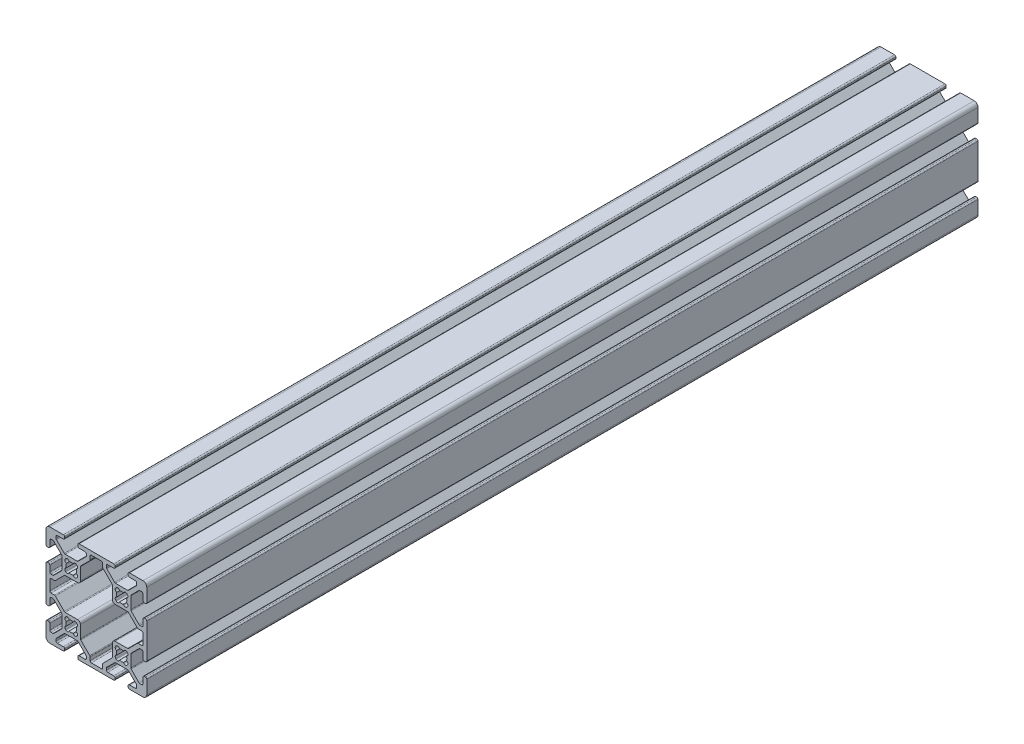
from build123d import *

# Parameters (mm, degrees)
EXTRUDE1_DEPTH = 330


with BuildPart() as part:
    # Sketch1 → Extrude1 (new body)
    with BuildSketch(Plane.XY):
        with BuildLine():
            Line((-22.383919339, -3.655), (-17.616080661, -3.655))
            ThreePointArc((-17.616080661, -3.655), (-17.421677478, -3.693669197), (-17.256870417, -3.803789755))
            Line((-17.256870417, -3.803789755), (-14.153789755, -6.906870417))
            ThreePointArc((-14.153789755, -6.906870417), (-14.043669197, -7.071677478), (-14.005, -7.266080661))
            Line((-14.005, -7.266080661), (-14.005, -7.992))
            ThreePointArc((-14.005, -7.992), (-14.153789755, -8.351210245), (-14.513, -8.5))
            Line((-14.513, -8.5), (-16.862, -8.5))
            ThreePointArc((-16.862, -8.5), (-17.221210245, -8.648789755), (-17.37, -9.008))
            Line((-17.37, -9.008), (-17.37, -9.492))
            ThreePointArc((-17.37, -9.492), (-17.221210245, -9.851210245), (-16.862, -10))
            Line((-16.862, -10), (-3.138, -10))
            ThreePointArc((-3.138, -10), (-2.778789755, -9.851210245), (-2.63, -9.492))
            Line((-2.63, -9.492), (-2.63, -9.008))
            ThreePointArc((-2.63, -9.008), (-2.778789755, -8.648789755), (-3.138, -8.5))
            Line((-3.138, -8.5), (-5.487, -8.5))
            ThreePointArc((-5.487, -8.5), (-5.846210245, -8.351210245), (-5.995, -7.992))
            Line((-5.995, -7.992), (-5.995, -7.266080661))
            ThreePointArc((-5.995, -7.266080661), (-5.956330803, -7.071677478), (-5.846210245, -6.906870417))
            Line((-5.846210245, -6.906870417), (-2.743129583, -3.803789755))
            ThreePointArc((-2.743129583, -3.803789755), (-2.578322522, -3.693669197), (-2.383919339, -3.655))
            Line((-2.383919339, -3.655), (2.383919339, -3.655))
            ThreePointArc((2.383919339, -3.655), (2.578322522, -3.693669197), (2.743129583, -3.803789755))
            Line((2.743129583, -3.803789755), (5.846210245, -6.906870417))
            ThreePointArc((5.846210245, -6.906870417), (5.956330803, -7.071677478), (5.995, -7.266080661))
            Line((5.995, -7.266080661), (5.995, -7.992))
            ThreePointArc((5.995, -7.992), (5.846210245, -8.351210245), (5.487, -8.5))
            Line((5.487, -8.5), (3.138, -8.5))
            ThreePointArc((3.138, -8.5), (2.778789755, -8.648789755), (2.63, -9.008))
            Line((2.63, -9.008), (2.63, -9.492))
            ThreePointArc((2.63, -9.492), (2.778789755, -9.851210245), (3.138, -10))
            Line((3.138, -10), (8.5, -10))
            ThreePointArc((8.5, -10), (9.560660172, -9.560660172), (10, -8.5))
            Line((10, -8.5), (10, -3.138))
            ThreePointArc((10, -3.138), (9.851210245, -2.778789755), (9.492, -2.63))
            Line((9.492, -2.63), (9.008, -2.63))
            ThreePointArc((9.008, -2.63), (8.648789755, -2.778789755), (8.5, -3.138))
            Line((8.5, -3.138), (8.5, -5.487))
            ThreePointArc((8.5, -5.487), (8.351210245, -5.846210245), (7.992, -5.995))
            Line((7.992, -5.995), (7.266080661, -5.995))
            ThreePointArc((7.266080661, -5.995), (7.071677478, -5.956330803), (6.906870417, -5.846210245))
            Line((6.906870417, -5.846210245), (3.803789755, -2.743129583))
            ThreePointArc((3.803789755, -2.743129583), (3.693669197, -2.578322522), (3.655, -2.383919339))
            Line((3.655, -2.383919339), (3.655, 2.383919339))
            ThreePointArc((3.655, 2.383919339), (3.693669197, 2.578322522), (3.803789755, 2.743129583))
            Line((3.803789755, 2.743129583), (6.906870417, 5.846210245))
            ThreePointArc((6.906870417, 5.846210245), (7.071677478, 5.956330803), (7.266080661, 5.995))
            Line((7.266080661, 5.995), (7.992, 5.995))
            ThreePointArc((7.992, 5.995), (8.351210245, 5.846210245), (8.5, 5.487))
            Line((8.5, 5.487), (8.5, 3.138))
            ThreePointArc((8.5, 3.138), (8.648789755, 2.778789755), (9.008, 2.63))
            Line((9.008, 2.63), (9.492, 2.63))
            ThreePointArc((9.492, 2.63), (9.851210245, 2.778789755), (10, 3.138))
            Line((10, 3.138), (10, 16.862))
            ThreePointArc((10, 16.862), (9.851210245, 17.221210245), (9.492, 17.37))
            Line((9.492, 17.37), (9.008, 17.37))
            ThreePointArc((9.008, 17.37), (8.648789755, 17.221210245), (8.5, 16.862))
            Line((8.5, 16.862), (8.5, 14.513))
            ThreePointArc((8.5, 14.513), (8.351210245, 14.153789755), (7.992, 14.005))
            Line((7.992, 14.005), (7.266080661, 14.005))
            ThreePointArc((7.266080661, 14.005), (7.071677478, 14.043669197), (6.906870417, 14.153789755))
            Line((6.906870417, 14.153789755), (3.803789755, 17.256870417))
            ThreePointArc((3.803789755, 17.256870417), (3.693669197, 17.421677478), (3.655, 17.616080661))
            Line((3.655, 17.616080661), (3.655, 22.383919339))
            ThreePointArc((3.655, 22.383919339), (3.693669197, 22.578322522), (3.803789755, 22.743129583))
            Line((3.803789755, 22.743129583), (6.906870417, 25.846210245))
            ThreePointArc((6.906870417, 25.846210245), (7.071677478, 25.956330803), (7.266080661, 25.995))
            Line((7.266080661, 25.995), (7.992, 25.995))
            ThreePointArc((7.992, 25.995), (8.351210245, 25.846210245), (8.5, 25.487))
            Line((8.5, 25.487), (8.5, 23.138))
            ThreePointArc((8.5, 23.138), (8.648789755, 22.778789755), (9.008, 22.63))
            Line((9.008, 22.63), (9.492, 22.63))
            ThreePointArc((9.492, 22.63), (9.851210245, 22.778789755), (10, 23.138))
            Line((10, 23.138), (10, 28.5))
            ThreePointArc((10, 28.5), (9.560660172, 29.560660172), (8.5, 30))
            Line((8.5, 30), (3.138, 30))
            ThreePointArc((3.138, 30), (2.778789755, 29.851210245), (2.63, 29.492))
            Line((2.63, 29.492), (2.63, 29.008))
            ThreePointArc((2.63, 29.008), (2.778789755, 28.648789755), (3.138, 28.5))
            Line((3.138, 28.5), (5.487, 28.5))
            ThreePointArc((5.487, 28.5), (5.846210245, 28.351210245), (5.995, 27.992))
            Line((5.995, 27.992), (5.995, 27.266080661))
            ThreePointArc((5.995, 27.266080661), (5.956330803, 27.071677478), (5.846210245, 26.906870417))
            Line((5.846210245, 26.906870417), (2.743129583, 23.803789755))
            ThreePointArc((2.743129583, 23.803789755), (2.578322522, 23.693669197), (2.383919339, 23.655))
            Line((2.383919339, 23.655), (-2.383919339, 23.655))
            ThreePointArc((-2.383919339, 23.655), (-2.578322522, 23.693669197), (-2.743129583, 23.803789755))
            Line((-2.743129583, 23.803789755), (-5.846210245, 26.906870417))
            ThreePointArc((-5.846210245, 26.906870417), (-5.956330803, 27.071677478), (-5.995, 27.266080661))
            Line((-5.995, 27.266080661), (-5.995, 27.992))
            ThreePointArc((-5.995, 27.992), (-5.846210245, 28.351210245), (-5.487, 28.5))
            Line((-5.487, 28.5), (-3.138, 28.5))
            ThreePointArc((-3.138, 28.5), (-2.778789755, 28.648789755), (-2.63, 29.008))
            Line((-2.63, 29.008), (-2.63, 29.492))
            ThreePointArc((-2.63, 29.492), (-2.778789755, 29.851210245), (-3.138, 30))
            Line((-3.138, 30), (-16.862, 30))
            ThreePointArc((-16.862, 30), (-17.221210245, 29.851210245), (-17.37, 29.492))
            Line((-17.37, 29.492), (-17.37, 29.008))
            ThreePointArc((-17.37, 29.008), (-17.221210245, 28.648789755), (-16.862, 28.5))
            Line((-16.862, 28.5), (-14.513, 28.5))
            ThreePointArc((-14.513, 28.5), (-14.153789755, 28.351210245), (-14.005, 27.992))
            Line((-14.005, 27.992), (-14.005, 27.266080661))
            ThreePointArc((-14.005, 27.266080661), (-14.043669197, 27.071677478), (-14.153789755, 26.906870417))
            Line((-14.153789755, 26.906870417), (-17.256870417, 23.803789755))
            ThreePointArc((-17.256870417, 23.803789755), (-17.421677478, 23.693669197), (-17.616080661, 23.655))
            Line((-17.616080661, 23.655), (-22.383919339, 23.655))
            ThreePointArc((-22.383919339, 23.655), (-22.578322522, 23.693669197), (-22.743129583, 23.803789755))
            Line((-22.743129583, 23.803789755), (-25.846210245, 26.906870417))
            ThreePointArc((-25.846210245, 26.906870417), (-25.956330803, 27.071677478), (-25.995, 27.266080661))
            Line((-25.995, 27.266080661), (-25.995, 27.992))
            ThreePointArc((-25.995, 27.992), (-25.846210245, 28.351210245), (-25.487, 28.5))
            Line((-25.487, 28.5), (-23.138, 28.5))
            ThreePointArc((-23.138, 28.5), (-22.778789755, 28.648789755), (-22.63, 29.008))
            Line((-22.63, 29.008), (-22.63, 29.492))
            ThreePointArc((-22.63, 29.492), (-22.778789755, 29.851210245), (-23.138, 30))
            Line((-23.138, 30), (-28.5, 30))
            ThreePointArc((-28.5, 30), (-29.560660172, 29.560660172), (-30, 28.5))
            Line((-30, 28.5), (-30, 23.138))
            ThreePointArc((-30, 23.138), (-29.851210245, 22.778789755), (-29.492, 22.63))
            Line((-29.492, 22.63), (-29.008, 22.63))
            ThreePointArc((-29.008, 22.63), (-28.648789755, 22.778789755), (-28.5, 23.138))
            Line((-28.5, 23.138), (-28.5, 25.487))
            ThreePointArc((-28.5, 25.487), (-28.351210245, 25.846210245), (-27.992, 25.995))
            Line((-27.992, 25.995), (-27.266080661, 25.995))
            ThreePointArc((-27.266080661, 25.995), (-27.071677478, 25.956330803), (-26.906870417, 25.846210245))
            Line((-26.906870417, 25.846210245), (-23.803789755, 22.743129583))
            ThreePointArc((-23.803789755, 22.743129583), (-23.693669197, 22.578322522), (-23.655, 22.383919339))
            Line((-23.655, 22.383919339), (-23.655, 17.616080661))
            ThreePointArc((-23.655, 17.616080661), (-23.693669197, 17.421677478), (-23.803789755, 17.256870417))
            Line((-23.803789755, 17.256870417), (-26.906870417, 14.153789755))
            ThreePointArc((-26.906870417, 14.153789755), (-27.071677478, 14.043669197), (-27.266080661, 14.005))
            Line((-27.266080661, 14.005), (-27.992, 14.005))
            ThreePointArc((-27.992, 14.005), (-28.351210245, 14.153789755), (-28.5, 14.513))
            Line((-28.5, 14.513), (-28.5, 16.862))
            ThreePointArc((-28.5, 16.862), (-28.648789755, 17.221210245), (-29.008, 17.37))
            Line((-29.008, 17.37), (-29.492, 17.37))
            ThreePointArc((-29.492, 17.37), (-29.851210245, 17.221210245), (-30, 16.862))
            Line((-30, 16.862), (-30, 3.138))
            ThreePointArc((-30, 3.138), (-29.851210245, 2.778789755), (-29.492, 2.63))
            Line((-29.492, 2.63), (-29.008, 2.63))
            ThreePointArc((-29.008, 2.63), (-28.648789755, 2.778789755), (-28.5, 3.138))
            Line((-28.5, 3.138), (-28.5, 5.487))
            ThreePointArc((-28.5, 5.487), (-28.351210245, 5.846210245), (-27.992, 5.995))
            Line((-27.992, 5.995), (-27.266080661, 5.995))
            ThreePointArc((-27.266080661, 5.995), (-27.071677478, 5.956330803), (-26.906870417, 5.846210245))
            Line((-26.906870417, 5.846210245), (-23.803789755, 2.743129583))
            ThreePointArc((-23.803789755, 2.743129583), (-23.693669197, 2.578322522), (-23.655, 2.383919339))
            Line((-23.655, 2.383919339), (-23.655, -2.383919339))
            ThreePointArc((-23.655, -2.383919339), (-23.693669197, -2.578322522), (-23.803789755, -2.743129583))
            Line((-23.803789755, -2.743129583), (-26.906870417, -5.846210245))
            ThreePointArc((-26.906870417, -5.846210245), (-27.071677478, -5.956330803), (-27.266080661, -5.995))
            Line((-27.266080661, -5.995), (-27.992, -5.995))
            ThreePointArc((-27.992, -5.995), (-28.351210245, -5.846210245), (-28.5, -5.487))
            Line((-28.5, -5.487), (-28.5, -3.138))
            ThreePointArc((-28.5, -3.138), (-28.648789755, -2.778789755), (-29.008, -2.63))
            Line((-29.008, -2.63), (-29.492, -2.63))
            ThreePointArc((-29.492, -2.63), (-29.851210245, -2.778789755), (-30, -3.138))
            Line((-30, -3.138), (-30, -8.5))
            ThreePointArc((-30, -8.5), (-29.560660172, -9.560660172), (-28.5, -10))
            Line((-28.5, -10), (-23.138, -10))
            ThreePointArc((-23.138, -10), (-22.778789755, -9.851210245), (-22.63, -9.492))
            Line((-22.63, -9.492), (-22.63, -9.008))
            ThreePointArc((-22.63, -9.008), (-22.778789755, -8.648789755), (-23.138, -8.5))
            Line((-23.138, -8.5), (-25.487, -8.5))
            ThreePointArc((-25.487, -8.5), (-25.846210245, -8.351210245), (-25.995, -7.992))
            Line((-25.995, -7.992), (-25.995, -7.266080661))
            ThreePointArc((-25.995, -7.266080661), (-25.956330803, -7.071677478), (-25.846210245, -6.906870417))
            Line((-25.846210245, -6.906870417), (-22.743129583, -3.803789755))
            ThreePointArc((-22.743129583, -3.803789755), (-22.578322522, -3.693669197), (-22.383919339, -3.655))
        make_face()
        with BuildLine():
            Line((-2.124900844, 17.695494034), (-2.304505966, 17.875099156))
            ThreePointArc((-2.304505966, 17.875099156), (-2.505938017, 18.643532189), (-1.935133506, 19.196023282))
            ThreePointArc((-1.935133506, 19.196023282), (-2.0955, 20), (-1.935133506, 20.803976718))
            ThreePointArc((-1.935133506, 20.803976718), (-2.505938017, 21.356467811), (-2.304505966, 22.124900844))
            Line((-2.304505966, 22.124900844), (-2.124900844, 22.304505966))
            ThreePointArc((-2.124900844, 22.304505966), (-1.356467811, 22.505938017), (-0.803976718, 21.935133506))
            ThreePointArc((-0.803976718, 21.935133506), (0, 22.0955), (0.803976718, 21.935133506))
            ThreePointArc((0.803976718, 21.935133506), (1.356467811, 22.505938017), (2.124900844, 22.304505966))
            Line((2.124900844, 22.304505966), (2.304505966, 22.124900844))
            ThreePointArc((2.304505966, 22.124900844), (2.505938017, 21.356467811), (1.935133506, 20.803976718))
            ThreePointArc((1.935133506, 20.803976718), (2.0955, 20), (1.935133506, 19.196023282))
            ThreePointArc((1.935133506, 19.196023282), (2.505938017, 18.643532189), (2.304505966, 17.875099156))
            Line((2.304505966, 17.875099156), (2.124900844, 17.695494034))
            ThreePointArc((2.124900844, 17.695494034), (1.356467811, 17.494061983), (0.803976718, 18.064866494))
            ThreePointArc((0.803976718, 18.064866494), (0, 17.9045), (-0.803976718, 18.064866494))
            ThreePointArc((-0.803976718, 18.064866494), (-1.356467811, 17.494061983), (-2.124900844, 17.695494034))
        make_face(mode=Mode.SUBTRACT)
        with BuildLine():
            Line((-22.124900844, 17.695494034), (-22.304505966, 17.875099156))
            ThreePointArc((-22.304505966, 17.875099156), (-22.505938017, 18.643532189), (-21.935133506, 19.196023282))
            ThreePointArc((-21.935133506, 19.196023282), (-22.0955, 20), (-21.935133506, 20.803976718))
            ThreePointArc((-21.935133506, 20.803976718), (-22.505938017, 21.356467811), (-22.304505966, 22.124900844))
            Line((-22.304505966, 22.124900844), (-22.124900844, 22.304505966))
            ThreePointArc((-22.124900844, 22.304505966), (-21.356467811, 22.505938017), (-20.803976718, 21.935133506))
            ThreePointArc((-20.803976718, 21.935133506), (-20, 22.0955), (-19.196023282, 21.935133506))
            ThreePointArc((-19.196023282, 21.935133506), (-18.643532189, 22.505938017), (-17.875099156, 22.304505966))
            Line((-17.875099156, 22.304505966), (-17.695494034, 22.124900844))
            ThreePointArc((-17.695494034, 22.124900844), (-17.494061983, 21.356467811), (-18.064866494, 20.803976718))
            ThreePointArc((-18.064866494, 20.803976718), (-17.9045, 20), (-18.064866494, 19.196023282))
            ThreePointArc((-18.064866494, 19.196023282), (-17.494061983, 18.643532189), (-17.695494034, 17.875099156))
            Line((-17.695494034, 17.875099156), (-17.875099156, 17.695494034))
            ThreePointArc((-17.875099156, 17.695494034), (-18.643532189, 17.494061983), (-19.196023282, 18.064866494))
            ThreePointArc((-19.196023282, 18.064866494), (-20, 17.9045), (-20.803976718, 18.064866494))
            ThreePointArc((-20.803976718, 18.064866494), (-21.356467811, 17.494061983), (-22.124900844, 17.695494034))
        make_face(mode=Mode.SUBTRACT)
        with BuildLine():
            Line((-2.124900844, -2.304505966), (-2.304505966, -2.124900844))
            ThreePointArc((-2.304505966, -2.124900844), (-2.505938017, -1.356467811), (-1.935133506, -0.803976718))
            ThreePointArc((-1.935133506, -0.803976718), (-2.0955, 0), (-1.935133506, 0.803976718))
            ThreePointArc((-1.935133506, 0.803976718), (-2.505938017, 1.356467811), (-2.304505966, 2.124900844))
            Line((-2.304505966, 2.124900844), (-2.124900844, 2.304505966))
            ThreePointArc((-2.124900844, 2.304505966), (-1.356467811, 2.505938017), (-0.803976718, 1.935133506))
            ThreePointArc((-0.803976718, 1.935133506), (0, 2.0955), (0.803976718, 1.935133506))
            ThreePointArc((0.803976718, 1.935133506), (1.356467811, 2.505938017), (2.124900844, 2.304505966))
            Line((2.124900844, 2.304505966), (2.304505966, 2.124900844))
            ThreePointArc((2.304505966, 2.124900844), (2.505938017, 1.356467811), (1.935133506, 0.803976718))
            ThreePointArc((1.935133506, 0.803976718), (2.0955, 0), (1.935133506, -0.803976718))
            ThreePointArc((1.935133506, -0.803976718), (2.505938017, -1.356467811), (2.304505966, -2.124900844))
            Line((2.304505966, -2.124900844), (2.124900844, -2.304505966))
            ThreePointArc((2.124900844, -2.304505966), (1.356467811, -2.505938017), (0.803976718, -1.935133506))
            ThreePointArc((0.803976718, -1.935133506), (0, -2.0955), (-0.803976718, -1.935133506))
            ThreePointArc((-0.803976718, -1.935133506), (-1.356467811, -2.505938017), (-2.124900844, -2.304505966))
        make_face(mode=Mode.SUBTRACT)
        with BuildLine():
            Line((-12.505, -7.992), (-12.505, -6.644760318))
            ThreePointArc((-12.505, -6.644760318), (-12.543669197, -6.450357134), (-12.653789755, -6.285550073))
            Line((-12.653789755, -6.285550073), (-16.196210245, -2.743129583))
            ThreePointArc((-16.196210245, -2.743129583), (-16.306330803, -2.578322522), (-16.345, -2.383919339))
            Line((-16.345, -2.383919339), (-16.345, 2.512))
            ThreePointArc((-16.345, 2.512), (-16.679776949, 3.320223051), (-17.488, 3.655))
            Line((-17.488, 3.655), (-22.383919339, 3.655))
            ThreePointArc((-22.383919339, 3.655), (-22.578322522, 3.693669197), (-22.743129583, 3.803789755))
            Line((-22.743129583, 3.803789755), (-26.285550073, 7.346210245))
            ThreePointArc((-26.285550073, 7.346210245), (-26.450357134, 7.456330803), (-26.644760318, 7.495))
            Line((-26.644760318, 7.495), (-27.992, 7.495))
            ThreePointArc((-27.992, 7.495), (-28.351210245, 7.643789755), (-28.5, 8.003))
            Line((-28.5, 8.003), (-28.5, 11.997))
            ThreePointArc((-28.5, 11.997), (-28.351210245, 12.356210245), (-27.992, 12.505))
            Line((-27.992, 12.505), (-26.644760318, 12.505))
            ThreePointArc((-26.644760318, 12.505), (-26.450357134, 12.543669197), (-26.285550073, 12.653789755))
            Line((-26.285550073, 12.653789755), (-22.743129583, 16.196210245))
            ThreePointArc((-22.743129583, 16.196210245), (-22.578322522, 16.306330803), (-22.383919339, 16.345))
            Line((-22.383919339, 16.345), (-17.488, 16.345))
            ThreePointArc((-17.488, 16.345), (-16.679776949, 16.679776949), (-16.345, 17.488))
            Line((-16.345, 17.488), (-16.345, 22.383919339))
            ThreePointArc((-16.345, 22.383919339), (-16.306330803, 22.578322522), (-16.196210245, 22.743129583))
            Line((-16.196210245, 22.743129583), (-12.653789755, 26.285550073))
            ThreePointArc((-12.653789755, 26.285550073), (-12.543669197, 26.450357134), (-12.505, 26.644760318))
            Line((-12.505, 26.644760318), (-12.505, 27.992))
            ThreePointArc((-12.505, 27.992), (-12.356210245, 28.351210245), (-11.997, 28.5))
            Line((-11.997, 28.5), (-8.003, 28.5))
            ThreePointArc((-8.003, 28.5), (-7.643789755, 28.351210245), (-7.495, 27.992))
            Line((-7.495, 27.992), (-7.495, 26.644760318))
            ThreePointArc((-7.495, 26.644760318), (-7.456330803, 26.450357134), (-7.346210245, 26.285550073))
            Line((-7.346210245, 26.285550073), (-3.803789755, 22.743129583))
            ThreePointArc((-3.803789755, 22.743129583), (-3.693669197, 22.578322522), (-3.655, 22.383919339))
            Line((-3.655, 22.383919339), (-3.655, 17.488))
            ThreePointArc((-3.655, 17.488), (-3.320223051, 16.679776949), (-2.512, 16.345))
            Line((-2.512, 16.345), (2.383919339, 16.345))
            ThreePointArc((2.383919339, 16.345), (2.578322522, 16.306330803), (2.743129583, 16.196210245))
            Line((2.743129583, 16.196210245), (6.285550073, 12.653789755))
            ThreePointArc((6.285550073, 12.653789755), (6.450357134, 12.543669197), (6.644760318, 12.505))
            Line((6.644760318, 12.505), (7.992, 12.505))
            ThreePointArc((7.992, 12.505), (8.351210245, 12.356210245), (8.5, 11.997))
            Line((8.5, 11.997), (8.5, 8.003))
            ThreePointArc((8.5, 8.003), (8.351210245, 7.643789755), (7.992, 7.495))
            Line((7.992, 7.495), (6.644760318, 7.495))
            ThreePointArc((6.644760318, 7.495), (6.450357134, 7.456330803), (6.285550073, 7.346210245))
            Line((6.285550073, 7.346210245), (2.743129583, 3.803789755))
            ThreePointArc((2.743129583, 3.803789755), (2.578322522, 3.693669197), (2.383919339, 3.655))
            Line((2.383919339, 3.655), (-2.512, 3.655))
            ThreePointArc((-2.512, 3.655), (-3.320223051, 3.320223051), (-3.655, 2.512))
            Line((-3.655, 2.512), (-3.655, -2.383919339))
            ThreePointArc((-3.655, -2.383919339), (-3.693669197, -2.578322522), (-3.803789755, -2.743129583))
            Line((-3.803789755, -2.743129583), (-7.346210245, -6.285550073))
            ThreePointArc((-7.346210245, -6.285550073), (-7.456330803, -6.450357134), (-7.495, -6.644760318))
            Line((-7.495, -6.644760318), (-7.495, -7.992))
            ThreePointArc((-7.495, -7.992), (-7.643789755, -8.351210245), (-8.003, -8.5))
            Line((-8.003, -8.5), (-11.997, -8.5))
            ThreePointArc((-11.997, -8.5), (-12.356210245, -8.351210245), (-12.505, -7.992))
        make_face(mode=Mode.SUBTRACT)
        with BuildLine():
            Line((-22.124900844, -2.304505966), (-22.304505966, -2.124900844))
            ThreePointArc((-22.304505966, -2.124900844), (-22.505938017, -1.356467811), (-21.935133506, -0.803976718))
            ThreePointArc((-21.935133506, -0.803976718), (-22.0955, 0), (-21.935133506, 0.803976718))
            ThreePointArc((-21.935133506, 0.803976718), (-22.505938017, 1.356467811), (-22.304505966, 2.124900844))
            Line((-22.304505966, 2.124900844), (-22.124900844, 2.304505966))
            ThreePointArc((-22.124900844, 2.304505966), (-21.356467811, 2.505938017), (-20.803976718, 1.935133506))
            ThreePointArc((-20.803976718, 1.935133506), (-20, 2.0955), (-19.196023282, 1.935133506))
            ThreePointArc((-19.196023282, 1.935133506), (-18.643532189, 2.505938017), (-17.875099156, 2.304505966))
            Line((-17.875099156, 2.304505966), (-17.695494034, 2.124900844))
            ThreePointArc((-17.695494034, 2.124900844), (-17.494061983, 1.356467811), (-18.064866494, 0.803976718))
            ThreePointArc((-18.064866494, 0.803976718), (-17.9045, 0), (-18.064866494, -0.803976718))
            ThreePointArc((-18.064866494, -0.803976718), (-17.494061983, -1.356467811), (-17.695494034, -2.124900844))
            Line((-17.695494034, -2.124900844), (-17.875099156, -2.304505966))
            ThreePointArc((-17.875099156, -2.304505966), (-18.643532189, -2.505938017), (-19.196023282, -1.935133506))
            ThreePointArc((-19.196023282, -1.935133506), (-20, -2.0955), (-20.803976718, -1.935133506))
            ThreePointArc((-20.803976718, -1.935133506), (-21.356467811, -2.505938017), (-22.124900844, -2.304505966))
        make_face(mode=Mode.SUBTRACT)
    extrude(amount=-EXTRUDE1_DEPTH)


solid = part.part
